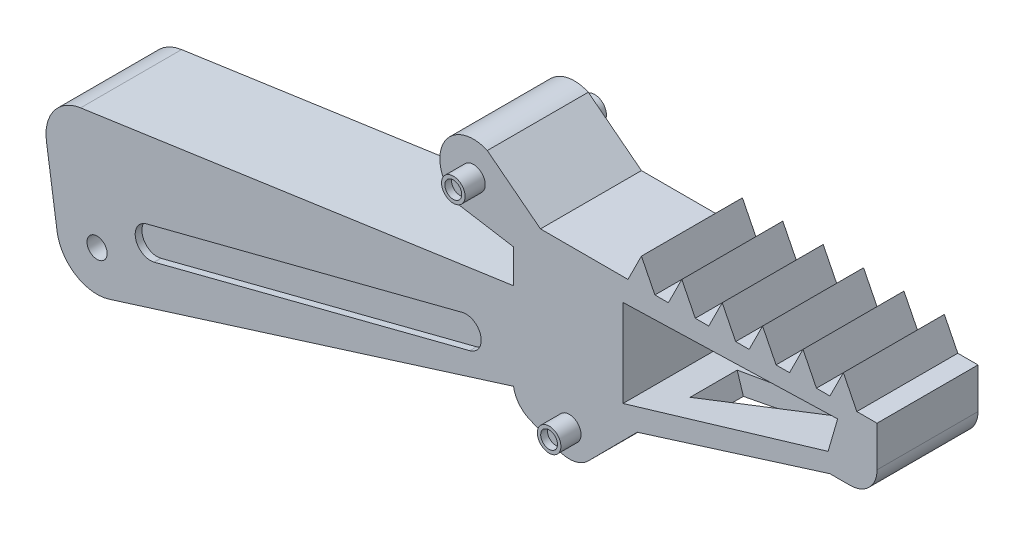
from build123d import *

# Parameters (mm, degrees)
BOSS_EXTRUDE1_DEPTH = 7.5
FILLET1_R           = 6
FILLET2_R           = 4
BOSS_EXTRUDE2_DEPTH = 15
LPATTERN1_COUNT     = 6
LPATTERN1_PITCH     = 6
CUT_EXTRUDE1_DEPTH  = 26
CUT_EXTRUDE2_DEPTH  = 5
SKETCH5_R           = 1.5
CUT_EXTRUDE3_DEPTH  = 130.931165931
SKETCH6_R           = 1.75
BOSS_EXTRUDE3_DEPTH = 3
SKETCH7_R           = 1.25
CUT_EXTRUDE4_DEPTH  = 1
SKETCH8_R           = 1.25
CUT_EXTRUDE5_DEPTH  = 1
CUT_EXTRUDE6_DEPTH  = 1


with BuildPart() as part:
    # Sketch1 → Boss-Extrude1 (new, symmetric)
    with BuildSketch(Plane(origin=(0, 0, 0), x_dir=(0, 1, 0), z_dir=(0, 0, 1))):
        with BuildLine():
            Line((-12.93657624, 0), (-36.683093305, -3.478926169))
            Line((-36.683093305, -3.478926169), (-15.74375395, -70.273716889))
            Line((-15.74375395, -70.273716889), (-17.80717771, -70.273716889))
            Line((-17.80717771, -70.273716889), (-21.696997284, -79.486170616))
            Line((-21.696997284, -79.486170616), (-12.467013439, -88.640808687))
            Line((-12.467013439, -88.640808687), (-3.493010858, -117.267147567))
            Line((-3.493010858, -117.267147567), (-3.493010858, -124.267147567))
            Line((-3.493010858, -124.267147567), (6.506989142, -124.267147567))
            Line((6.506989142, -124.267147567), (6.506989142, -74.267147567))
            Line((6.506989142, -74.267147567), (12.638392495, -66.367407513))
            ThreePointArc((12.638392495, -66.367407513), (10.129821893, -59.756274968), (3.518689347, -62.26484557))
            Line((3.518689347, -62.26484557), (2.19282229, -70.273716889))
            Line((2.19282229, -70.273716889), (-2.80717771, -70.273716889))
            Line((-2.80717771, -70.273716889), (-12.93657624, 0))
        make_face()
    extrude(amount=BOSS_EXTRUDE1_DEPTH, both=True)

    # Fillet1
    fillet1_edges = [part.edges().sort_by_distance(p)[0] for p in [
        (3.478926169, -36.683093305, 0),
        (0, -12.93657624, 0),
    ]]
    fillet(fillet1_edges, radius=FILLET1_R)

    # Fillet2
    # the kernel refuses this fillet: 4 mm, written as the material it takes off along each edge
    with BuildSketch(Plane(origin=(124.267147567, -3.493010858, -17.5), x_dir=(0, 1, 0), z_dir=(0, 0, 1))) as fillet2_piece_1:
        with BuildLine():
            CenterArc((FILLET2_R, FILLET2_R), FILLET2_R, 180, 90)
            Line((0, FILLET2_R), (-FILLET2_R * 0.02, FILLET2_R))
            Line((-FILLET2_R * 0.02, FILLET2_R), (-FILLET2_R * 0.02, -FILLET2_R * 0.02))
            Line((-FILLET2_R * 0.02, -FILLET2_R * 0.02), (FILLET2_R, -FILLET2_R * 0.02))
            Line((FILLET2_R, -FILLET2_R * 0.02), (FILLET2_R, 0))
        make_face()
    extrude(amount=35, mode=Mode.SUBTRACT)
    with BuildSketch(Plane(origin=(70.273716889, -17.80717771, -14.005853421), x_dir=(0, 1, 0), z_dir=(0, 0, 1))) as fillet2_piece_2_section:
        with BuildLine():
            CenterArc((2.672717651, -3.953322774), FILLET2_R, 98.761599305, 58.347232051)
            Line((-1.012263839, -2.397394944), (-1.085963469, -2.366276387))
            Line((-1.085963469, -2.366276387), (-0.07369963, 0.031118557))
            Line((-0.07369963, 0.031118557), (0, 0.08))
            ThreePointArc((0, 0.08), (1.03171188, 0.08), (2.051237882, 0.079066455))
            Line((2.051237882, 0.079066455), (2.06342376, 0))
        make_face()
    fillet2_piece_2 = extrude(amount=28.011706842, mode=Mode.PRIVATE)
    fillet2_piece_2 = split(fillet2_piece_2, bisect_by=Plane(origin=(70.257081216, -15.748969027, 0), z_dir=(0.2991334193615799, -0.954211296003694, 0)), keep=Keep.TOP, mode=Mode.PRIVATE)
    add(fillet2_piece_2, mode=Mode.SUBTRACT)
    with BuildSketch(Plane(origin=(79.486170616, -21.696997284, -14.26109301), x_dir=(-0.9212453727262618, 0.3889819574613337, 0), z_dir=(0, 0, 1))) as fillet2_piece_3:
        with BuildLine():
            CenterArc((FILLET2_R * 0.676109301023, -FILLET2_R), FILLET2_R, 90, 68.125982867)
            Line((-FILLET2_R * 0.251896002422, -FILLET2_R * 0.627433017057), (-FILLET2_R * 0.270456108491, -FILLET2_R * 0.619981677398))
            Line((-FILLET2_R * 0.270456108491, -FILLET2_R * 0.619981677398), (-FILLET2_R * 0.0135221860205, FILLET2_R * 0.02))
            Line((-FILLET2_R * 0.0135221860205, FILLET2_R * 0.02), (FILLET2_R * 0.676109301023, FILLET2_R * 0.02))
            Line((FILLET2_R * 0.676109301023, FILLET2_R * 0.02), (FILLET2_R * 0.676109301023, 0))
        make_face()
    extrude(amount=28.52218602, mode=Mode.SUBTRACT)

    # Sketch2 → Boss-Extrude2 (add)
    with BuildSketch(Plane.XY.offset(7.5)):
        Polygon((119.267147567, 6.506989142), (121.267147567, 6.506989142), (119.267147567, 10.506989142), align=None)
        Polygon((117.267147567, 6.506989142), (119.267147567, 6.506989142), (119.267147567, 10.506989142), align=None)
    boss_extrude2 = extrude(amount=-BOSS_EXTRUDE2_DEPTH)

    # LPattern1: Boss-Extrude2 ×6
    with Locations(*[(-i * LPATTERN1_PITCH, 0, 0) for i in range(1, LPATTERN1_COUNT)]):
        add(boss_extrude2)

    # Sketch3 → Cut-Extrude1 (cut)
    with BuildSketch(Plane.XY.offset(7.5)):
        Polygon((118.41479062, 4.13462657), (86.532799982, 3.176685284), (86.532799982, -9.820815038), (116.995150337, -0.75112261), align=None)
    extrude(amount=-CUT_EXTRUDE1_DEPTH, mode=Mode.SUBTRACT)

    # Sketch4 → Cut-Extrude2 (cut)
    with BuildSketch(Plane(origin=(11.490191231, -36.652776175, 0), x_dir=(0.954211296003694, 0.2991334193615799, 0), z_dir=(0.29913341936157983, -0.9542112960036939, 0))):
        Polygon((85.852760577, 3.5), (85.852760577, -3.5), (106.852760577, -0.5), (106.852760577, 0.5), align=None)
    extrude(amount=-CUT_EXTRUDE2_DEPTH, mode=Mode.SUBTRACT)

    # Sketch5 → Cut-Extrude3 (cut, through all)
    with BuildSketch(Plane.XY.offset(7.5)):
        with Locations((8.395954367, -28.853750382)):
            Circle(SKETCH5_R)
    extrude(amount=-CUT_EXTRUDE3_DEPTH, mode=Mode.SUBTRACT)

    # Sketch6 → Boss-Extrude3 (add)
    with BuildSketch(Plane.XY.offset(7.5)):
        with Locations(Location((78.550648186, -16.960038516, 0), (0, 0, 180))):
            Circle(SKETCH6_R)
        with Locations(Location((64.316126541, 8.078540921, 0), (0, 0, 180))):
            Circle(SKETCH6_R)
    boss_extrude3 = extrude(amount=BOSS_EXTRUDE3_DEPTH)

    # Sketch7 → Cut-Extrude4 (cut)
    with BuildSketch(Plane.XY.offset(10.5)):
        with Locations((78.550648186, -16.960038516)):
            Circle(SKETCH7_R)
    cut_extrude4 = extrude(amount=-CUT_EXTRUDE4_DEPTH, mode=Mode.SUBTRACT)

    # Sketch8 → Cut-Extrude5 (cut)
    with BuildSketch(Plane.XY.offset(10.5)):
        with Locations((64.316126541, 8.078540921)):
            Circle(SKETCH8_R)
    cut_extrude5 = extrude(amount=-CUT_EXTRUDE5_DEPTH, mode=Mode.SUBTRACT)

    # Sketch9 → Cut-Extrude6 (cut)
    with BuildSketch(Plane.XY.offset(7.5)):
        with BuildLine():
            Line((15.753388713, -22.103953925), (62.646298586, -10.0457771))
            ThreePointArc((62.646298586, -10.0457771), (65.390728962, -11.667485959), (63.769020103, -14.411916335))
            Line((63.769020103, -14.411916335), (16.87611023, -26.470093159))
            ThreePointArc((16.87611023, -26.470093159), (14.131679854, -24.848384301), (15.753388713, -22.103953925))
        make_face()
    cut_extrude6 = extrude(amount=-CUT_EXTRUDE6_DEPTH, mode=Mode.SUBTRACT)

    # Mirror1: Boss-Extrude3, Cut-Extrude4, Cut-Extrude5, Cut-Extrude6 across plane
    add(boss_extrude3.mirror(Plane.XY))
    add(cut_extrude4.mirror(Plane.XY), mode=Mode.SUBTRACT)
    add(cut_extrude5.mirror(Plane.XY), mode=Mode.SUBTRACT)
    add(cut_extrude6.mirror(Plane.XY), mode=Mode.SUBTRACT)


solid = part.part
